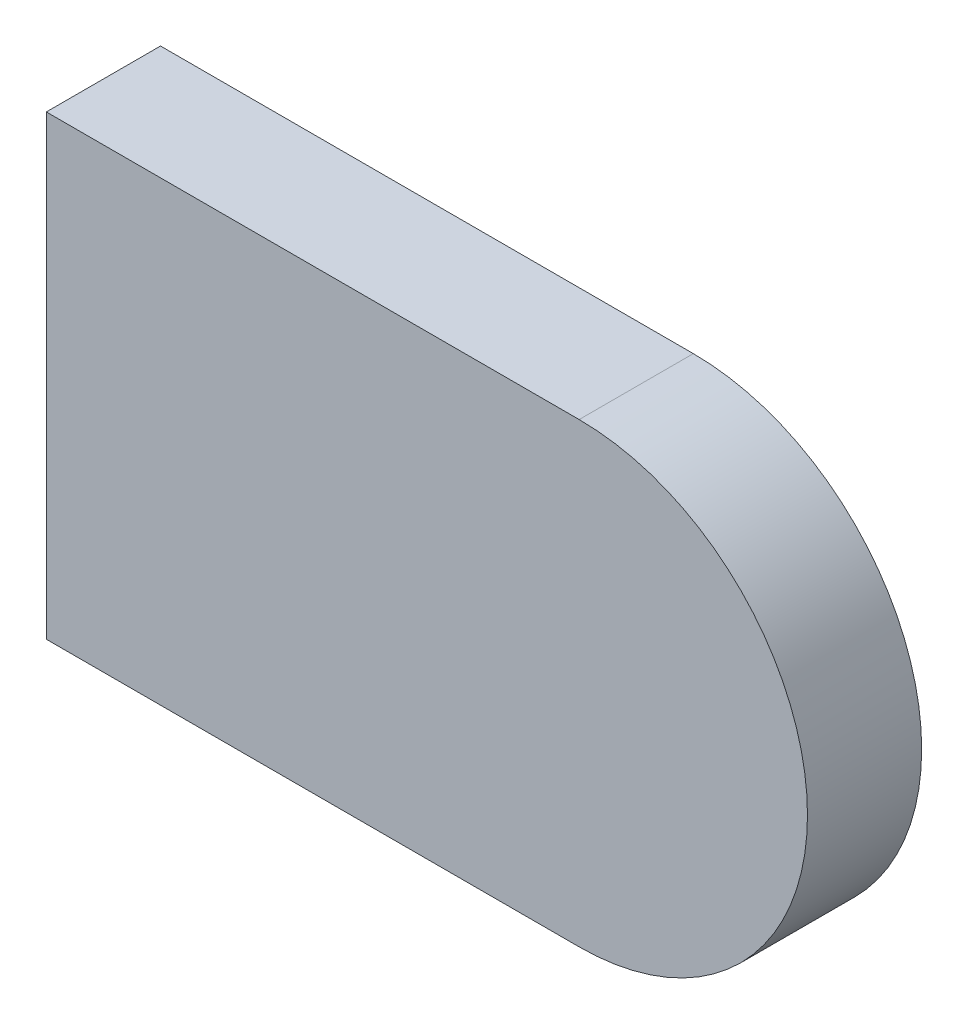
from build123d import *

# Parameters (mm, degrees)
BOSS_EXTRUDE1_DEPTH = 19.05
SKETCH3_R           = 6.35
CUT_EXTRUDE1_DEPTH  = 25.4


with BuildPart() as part:
    # Sketch1 → Boss-Extrude1 (new body)
    with BuildSketch(Plane.XY):
        with BuildLine():
            Line((0, 0), (88.903356144, 0))
            ThreePointArc((88.903356144, 0), (115.837719997, 11.159557314), (126.996625166, 38.094191625))
            ThreePointArc((126.996625166, 38.094191625), (115.840640047, 65.037521475), (88.9, 76.199999999))
            Line((88.9, 76.199999999), (0, 76.199999999))
            Line((0, 76.199999999), (0, 0))
        make_face()
    extrude(amount=BOSS_EXTRUDE1_DEPTH)

    # Sketch3 → Cut-Extrude1 (cut)
    with BuildSketch(Plane.ZY):
        with Locations((9.525, 38.1)):
            Circle(SKETCH3_R)
    extrude(amount=-CUT_EXTRUDE1_DEPTH, mode=Mode.SUBTRACT)


solid = part.part
